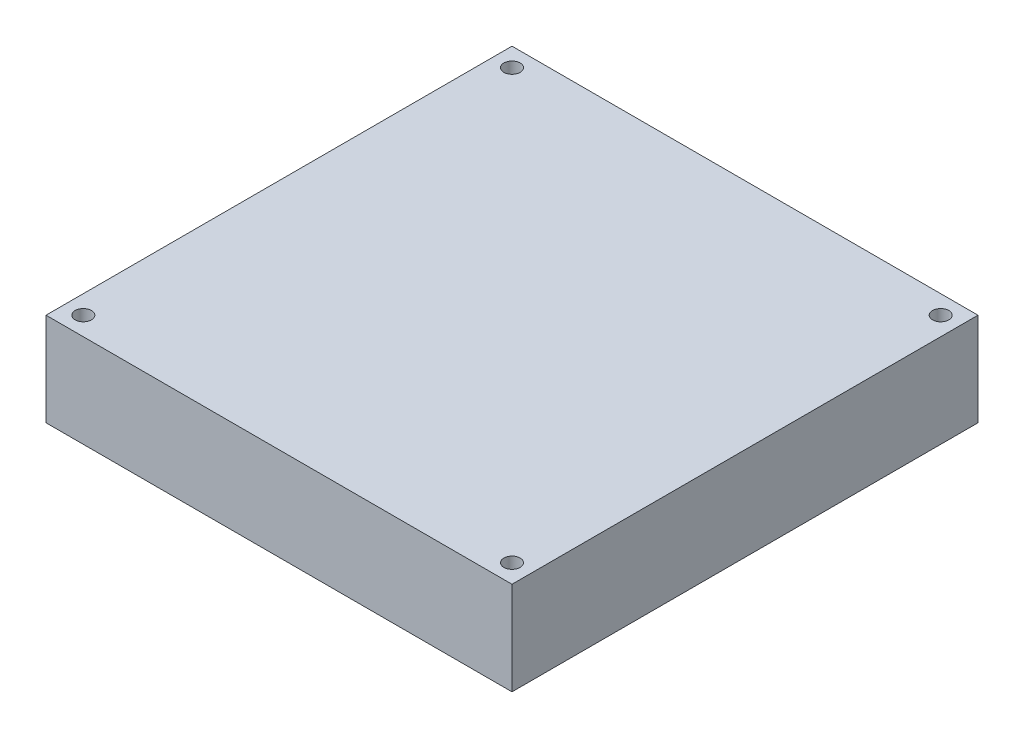
from build123d import *

# Parameters (mm, degrees)
SKETCH1_W           = 100
SKETCH1_H           = 100
SKETCH1_R           = 1.75
BOSS_EXTRUDE1_DEPTH = 20


with BuildPart() as part:
    # Sketch1 → Boss-Extrude1 (new body)
    with BuildSketch(Plane(origin=(0, 0, 0), x_dir=(1, 0, 0), z_dir=(0, 1, 0))):
        with Locations((-50, 50)):
            Rectangle(SKETCH1_W, SKETCH1_H)
        with Locations((-96, 96)):
            Circle(SKETCH1_R, mode=Mode.SUBTRACT)
        with Locations((-96, 4)):
            Circle(SKETCH1_R, mode=Mode.SUBTRACT)
        with Locations((-4, 4)):
            Circle(SKETCH1_R, mode=Mode.SUBTRACT)
        with Locations((-4, 96)):
            Circle(SKETCH1_R, mode=Mode.SUBTRACT)
    extrude(amount=BOSS_EXTRUDE1_DEPTH)


solid = part.part
